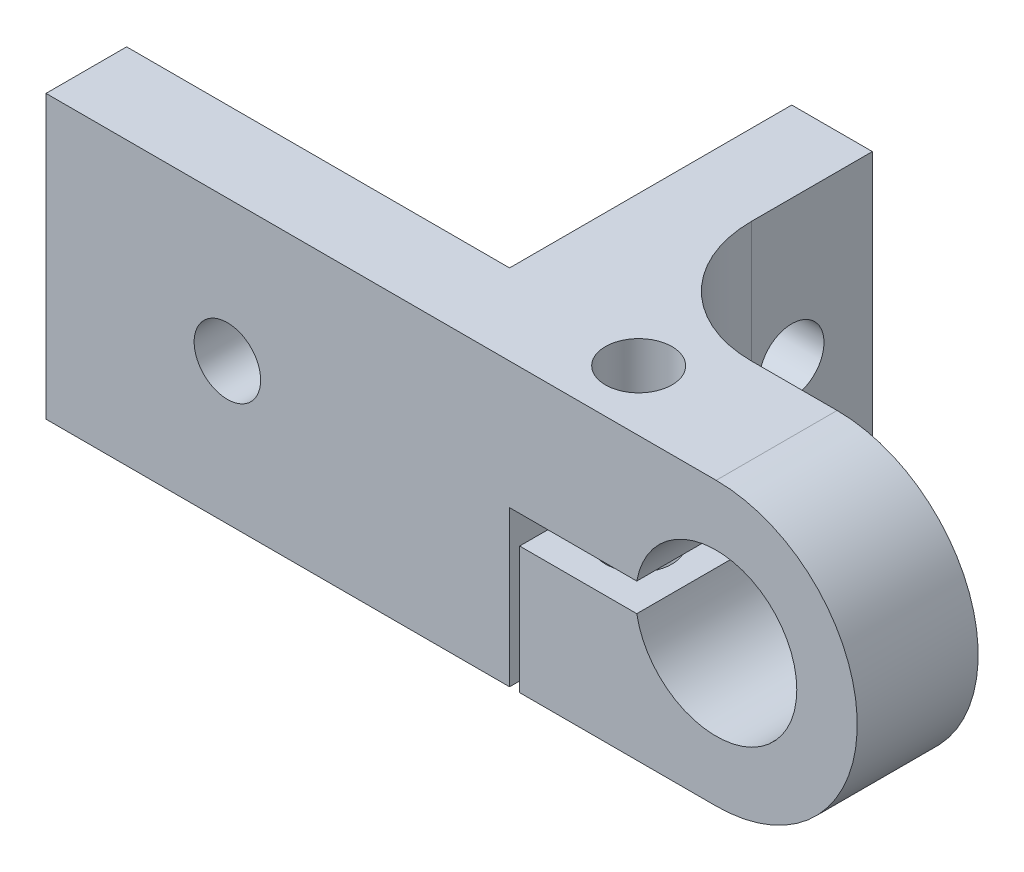
from build123d import *

# Parameters (mm, degrees)
ESBO_O2_R                  = 1.65
RESSALTO_EXTRUS_O1_DEPTH   = 18
CORTE_EXTRUS_O1_DEPTH      = 41.318265092
CORTE_EXTRUS_O1_DEPTH_BACK = 41.318265092
ESBO_O3_R                  = 1.65
ESBO_O3_W                  = 19
ESBO_O3_H                  = 14
ESBO_O4_R                  = 1.6
CORTE_EXTRUS_O2_DEPTH      = 18


with BuildPart() as part:
    # Esboço2 → Ressalto-extrusão1 (new body)
    with BuildSketch(Plane.XY):
        with BuildLine():
            Line((0, 7), (-33.25, 7))
            Line((-33.25, 7), (-33.25, -7))
            Line((-33.25, -7), (-10.25, -7))
            Line((-10.25, -7), (-10.25, 0.7))
            Line((-10.25, 0.7), (-3.938273734, 0.7))
            ThreePointArc((-3.938273734, 0.7), (4, 0), (-3.938273734, -0.7))
            Line((-3.938273734, -0.7), (-9.75, -0.7))
            Line((-9.75, -0.7), (-9.75, -7))
            Line((-9.75, -7), (0, -7))
            ThreePointArc((0, -7), (7, 0), (0, 7))
        make_face()
        with Locations((-24.25, 0)):
            Circle(ESBO_O2_R, mode=Mode.SUBTRACT)
    extrude(amount=RESSALTO_EXTRUS_O1_DEPTH)

    # Esboço3 → Corte-extrusão1 (cut, two sides: drawn at the far end of the back side and taken through both)
    with BuildSketch(Plane.XZ.offset(7).offset(-CORTE_EXTRUS_O1_DEPTH_BACK)):
        with Locations((-6.844136867, 15)):
            Circle(ESBO_O3_R)
        with Locations((-23.75, 7)):
            Rectangle(ESBO_O3_W, ESBO_O3_H)
        with BuildLine():
            Line((7, 12), (-4.25, 12))
            ThreePointArc((-4.25, 12), (-8.492640687, 10.242640687), (-10.25, 6))
            Line((-10.25, 6), (-10.25, 0))
            Line((-10.25, 0), (7, 0))
            Line((7, 0), (7, 12))
        make_face()
    extrude(amount=CORTE_EXTRUS_O1_DEPTH + CORTE_EXTRUS_O1_DEPTH_BACK, mode=Mode.SUBTRACT)

    # Esboço4 → Corte-extrusão2 (cut)
    with BuildSketch(Plane.ZY.offset(14.25)):
        with Locations((4, 0)):
            Circle(ESBO_O4_R)
    extrude(amount=-CORTE_EXTRUS_O2_DEPTH, mode=Mode.SUBTRACT)


solid = part.part
